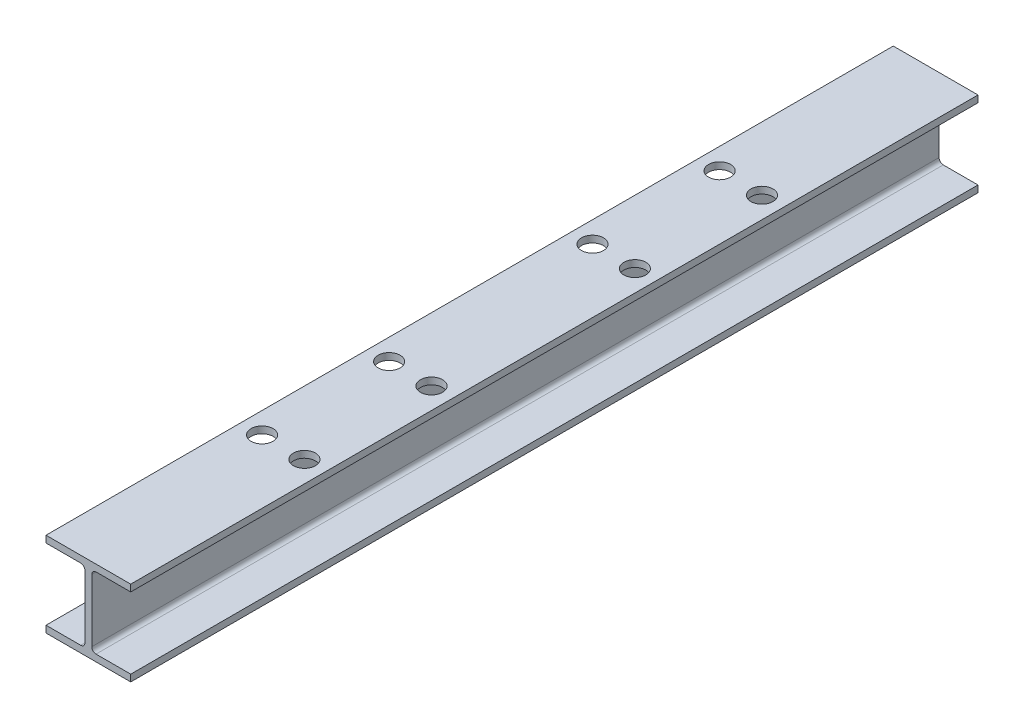
from build123d import *

# Parameters (mm, degrees)
BOSS_EXTRUDE1_DEPTH = 1000
FILLET1_R           = 5
SKETCH2_R           = 13
CUT_EXTRUDE1_DEPTH  = 10
SKETCH3_R           = 13
CUT_EXTRUDE2_DEPTH  = 10
SKETCH4_W           = 10
SKETCH4_H           = 30
BOSS_EXTRUDE2_DEPTH = 146
SKETCH6_R           = 15
BOSS_EXTRUDE4_DEPTH = 10
SPLIT1_START        = 495
SPLIT1_OUTLINE_R    = 15
SPLIT1_DEPTH        = 10
SPLIT2_START        = 495
SPLIT2_OUTLINE_R    = 15
SPLIT2_DEPTH        = 10


# Read off the part's stored shape, not the designer's step: Split1, Split2
with BuildPart() as part:
    # Sketch1 → Boss-Extrude1 (new body)
    with BuildSketch(Plane.XY):
        Polygon((-50, 42), (-4, 42), (-4, -42), (-50, -42), (-50, -50), (50, -50), (50, -42), (4, -42), (4, 42), (50, 42), (50, 50), (-50, 50), align=None)
    extrude(amount=BOSS_EXTRUDE1_DEPTH)

    # Fillet1
    fillet1_edges = [part.edges().sort_by_distance(p)[0] for p in [
        (4, 42, 500),
        (4, -42, 500),
        (-4, -42, 500),
        (-4, 42, 500),
    ]]
    fillet(fillet1_edges, radius=FILLET1_R)

    # Sketch2 → Cut-Extrude1 (cut)
    with BuildSketch(Plane(origin=(0, 50, 0), x_dir=(1, 0, 0), z_dir=(0, 1, 0))):
        with Locations(Location((25, -770, 0), (0, 0, 270))):
            Circle(SKETCH2_R)
        with Locations(Location((-25, -770, 0), (0, 0, 270))):
            Circle(SKETCH2_R)
        with Locations(Location((25, -230, 0), (0, 0, 270))):
            Circle(SKETCH2_R)
        with Locations(Location((-25, -230, 0), (0, 0, 270))):
            Circle(SKETCH2_R)
    extrude(amount=-CUT_EXTRUDE1_DEPTH, mode=Mode.SUBTRACT)

    # Sketch3 → Cut-Extrude2 (cut)
    with BuildSketch(Plane(origin=(0, 50, 0), x_dir=(1, 0, 0), z_dir=(0, 1, 0))):
        with Locations(Location((-25, -620, 0), (0, 0, 270))):
            Circle(SKETCH3_R)
        with Locations(Location((25, -620, 0), (0, 0, 270))):
            Circle(SKETCH3_R)
        with Locations(Location((25, -380, 0), (0, 0, 270))):
            Circle(SKETCH3_R)
        with Locations(Location((-25, -380, 0), (0, 0, 270))):
            Circle(SKETCH3_R)
    extrude(amount=-CUT_EXTRUDE2_DEPTH, mode=Mode.SUBTRACT)

    # Sketch4 → Boss-Extrude2 (add)
    with BuildSketch(Plane(origin=(4, 0, 0), x_dir=(0, 0, -1), z_dir=(1, 0, 0))):
        with Locations((-500, -5.392878346)):
            Rectangle(SKETCH4_W, SKETCH4_H)
    boss_extrude2 = extrude(amount=BOSS_EXTRUDE2_DEPTH)

    # Sketch6 → Boss-Extrude4 (add)
    with BuildSketch(Plane.XY.offset(505)):
        Polygon((150, 9.607121654), (150, -70.392878346), (180, -70.392878346), (220, -20.392878346), (220, 9.607121654), align=None)
        with Locations((185, -10.392878346)):
            Circle(SKETCH6_R, mode=Mode.SUBTRACT)
    boss_extrude4 = extrude(amount=-BOSS_EXTRUDE4_DEPTH)

    # Mirror1: Boss-Extrude2, Boss-Extrude4 across plane
    add(boss_extrude2.mirror(Plane(origin=(0, 0, 0), x_dir=(0, 0, 1), z_dir=(1, 0, 0))))
    add(boss_extrude4.mirror(Plane(origin=(0, 0, 0), x_dir=(0, 0, 1), z_dir=(1, 0, 0))))

    # Split1 outline → Split1 (cut)
    with BuildSketch(Plane.XY.offset(SPLIT1_START)):
        Polygon((-150, -20.392878346), (-4, -20.392878346), (-4, 9.607121654), (-220, 9.607121654), (-220, -20.392878346), (-180, -70.392878346), (-150, -70.392878346), align=None)
        with Locations((-185, -10.392878346)):
            Circle(SPLIT1_OUTLINE_R, mode=Mode.SUBTRACT)
    extrude(amount=SPLIT1_DEPTH, mode=Mode.SUBTRACT)

    # Split2 outline → Split2 (cut)
    with BuildSketch(Plane.XY.offset(SPLIT2_START)):
        Polygon((4, -20.392878346), (150, -20.392878346), (150, -70.392878346), (180, -70.392878346), (220, -20.392878346), (220, 9.607121654), (4, 9.607121654), align=None)
        with Locations((185, -10.392878346)):
            Circle(SPLIT2_OUTLINE_R, mode=Mode.SUBTRACT)
    extrude(amount=SPLIT2_DEPTH, mode=Mode.SUBTRACT)


solid = part.part
